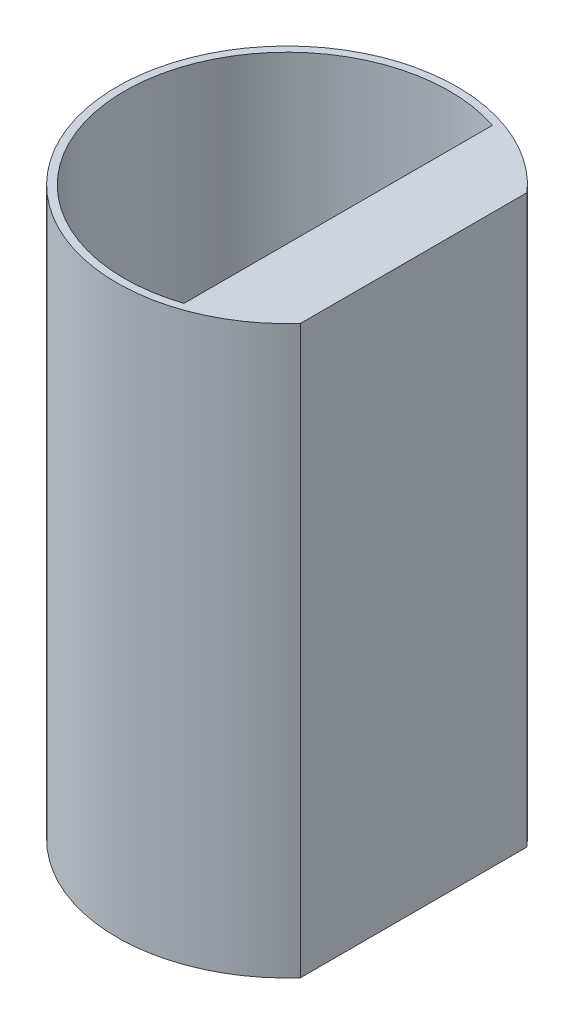
from build123d import *

# Parameters (mm, degrees)
BOSS_EXTRUDE1_DEPTH = 75
SHELL4_START        = 5
SHELL4_DEPTH        = 70


# Read off the part's stored shape, not the designer's step: Shell4
with BuildPart() as part:
    # Sketch1 → Boss-Extrude1 (new body)
    with BuildSketch(Plane(origin=(0, 0, 0), x_dir=(1, 0, 0), z_dir=(0, 1, 0))):
        with BuildLine():
            Line((16.770509831, 15), (16.770509831, -15))
            ThreePointArc((16.770509831, -15), (-22.5, 0), (16.770509831, 15))
        make_face()
    extrude(amount=BOSS_EXTRUDE1_DEPTH)

    # Shell4 outline → Shell4 (cut)
    with BuildSketch(Plane(origin=(0, 0, 0), x_dir=(1, 0, 0), z_dir=(0, 1, 0)).offset(SHELL4_START)):
        with BuildLine():
            ThreePointArc((6.770509831, 20.406131349), (-21.5, 0), (6.770509831, -20.406131349))
            Line((6.770509831, -20.406131349), (6.770509831, 20.406131349))
        make_face()
    extrude(amount=SHELL4_DEPTH, mode=Mode.SUBTRACT)


solid = part.part
